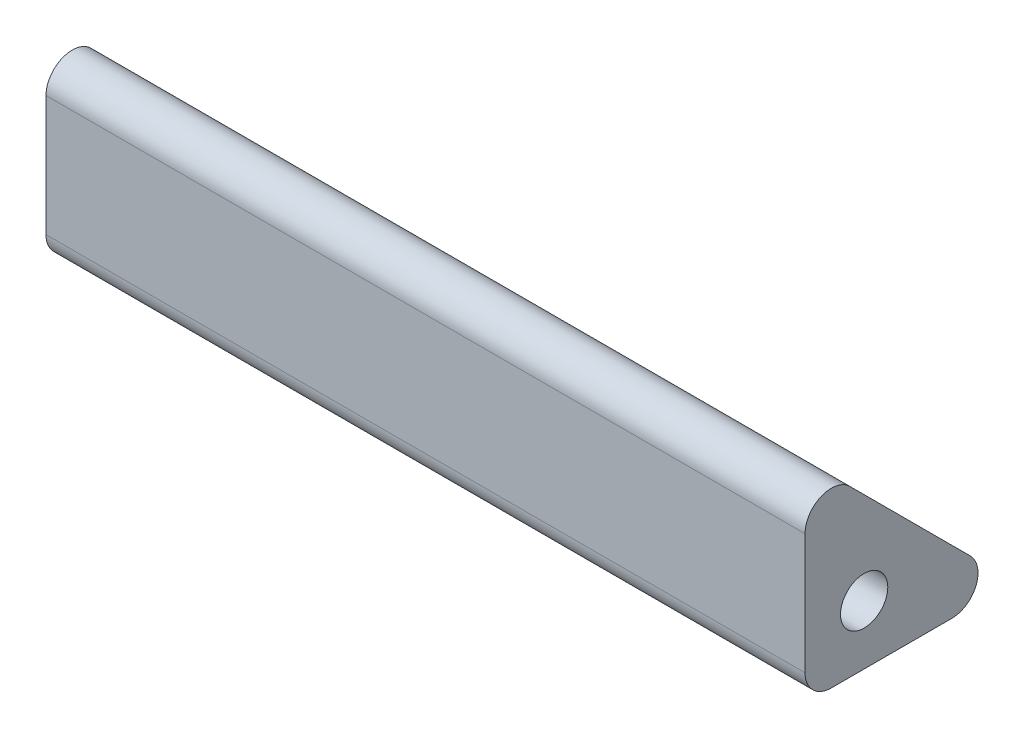
from build123d import *

# Parameters (mm, degrees)
SKETCH1_R           = 0.9
BOSS_EXTRUDE1_DEPTH = 28.9
FILLET1_R           = 1


with BuildPart() as part:
    # Sketch1 → Boss-Extrude1 (new body)
    with BuildSketch(Plane(origin=(0, 0, 0), x_dir=(0, 0, -1), z_dir=(1, 0, 0))):
        Polygon((-2.25, 5.75), (-2.25, -2.25), (5.75, -2.25), align=None)
        Circle(SKETCH1_R, mode=Mode.SUBTRACT)
    extrude(amount=BOSS_EXTRUDE1_DEPTH)

    # Fillet1
    fillet1_edges = [part.edges().sort_by_distance(p)[0] for p in [
        (14.45, -2.25, 2.25),
        (14.45, -2.25, -5.75),
        (14.45, 5.75, 2.25),
    ]]
    fillet(fillet1_edges, radius=FILLET1_R)


solid = part.part
